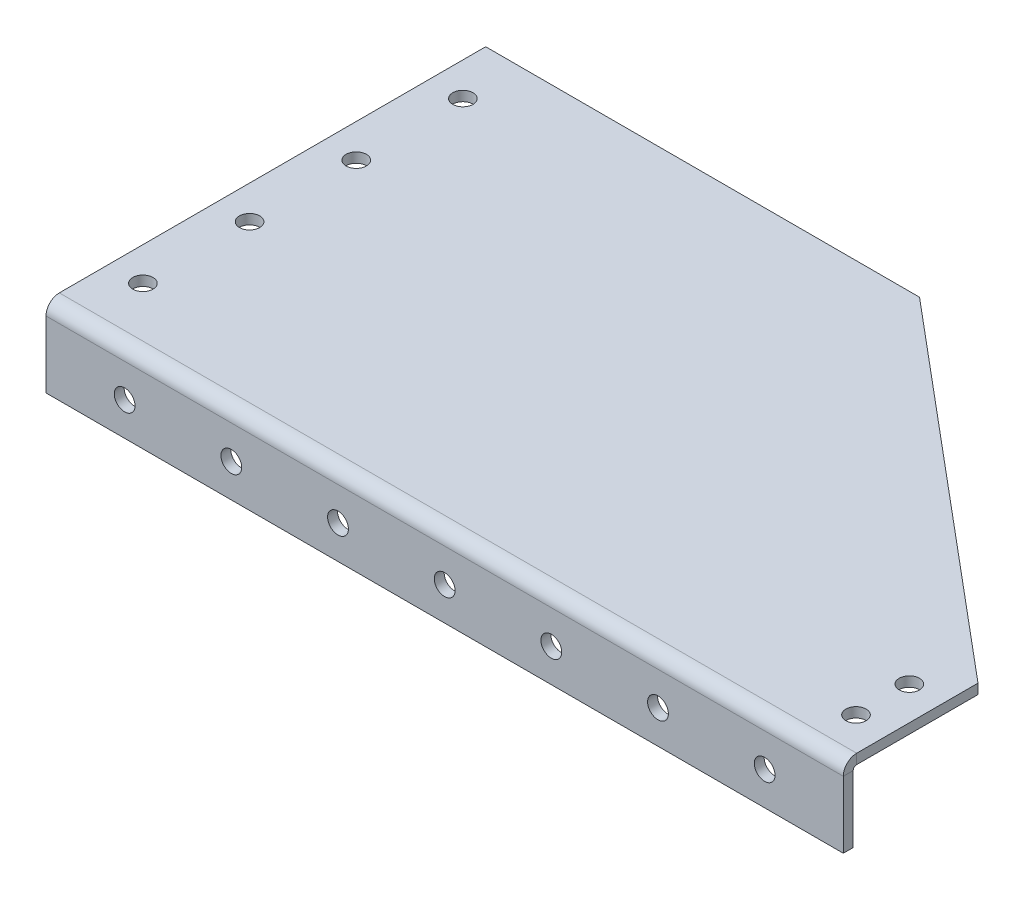
from build123d import *

# Parameters (mm, degrees)
SKETCH1_W                    = 189.8572
SKETCH1_H                    = 175.514
BASE_FLANGE1_DEPTH           = 2.3622
EDGE_FLANGE4_STRIP_W         = 11.0744
EDGE_FLANGE4_STRIP_H         = 2.3622
EDGE_FLANGE4_STRIP_CUT_DEPTH = 189.8572
EDGE_FLANGE4_DEPTH           = 189.8572
CUT_EXTRUDE1_DEPTH           = 145.352665205
CUT_EXTRUDE5_REACH           = 151.669
SKETCH41_R                   = 2.4765
CUT_EXTRUDE6_REACH           = 138.891
SKETCH42_R                   = 2.413


# Sheet-metal steps are written as plain solids
with BuildPart() as part:
    # Sketch1 → Base-Flange1 (new body)
    with BuildSketch(Plane(origin=(0, 0, 0), x_dir=(1, 0, 0), z_dir=(0, 1, 0))):
        with Locations((12.6128, 7.08)):
            Rectangle(SKETCH1_W, SKETCH1_H)
    extrude(amount=-BASE_FLANGE1_DEPTH)

    # Edge-Flange4 strip (across the edge) → Edge-Flange4 strip cut (cut)
    with BuildSketch(Plane(origin=(107.5414, -2.3622, 80.677), x_dir=(0, 0, -1), z_dir=(-1, 0, 0))):
        with Locations((-4.7244, -1.1811)):
            Rectangle(EDGE_FLANGE4_STRIP_W, EDGE_FLANGE4_STRIP_H)
    extrude(amount=EDGE_FLANGE4_STRIP_CUT_DEPTH, mode=Mode.SUBTRACT)

    # Edge-Flange4 section (across the edge) → Edge-Flange4 (add)
    with BuildSketch(Plane(origin=(107.5414, -2.3622, 80.677), x_dir=(0, 0, -1), z_dir=(-1, 0, 0))):
        with BuildLine():
            Line((-2.3622, 0.8128), (-2.3622, 16.6878))
            Line((-2.3622, 16.6878), (0, 16.6878))
            Line((0, 16.6878), (0, 0.8128))
            ThreePointArc((0, 0.8128), (0.238063608, 0.238063608), (0.8128, 0))
            Line((0.8128, 0), (0.8128, -2.3622))
            ThreePointArc((0.8128, -2.3622), (-1.43226403, -1.43226403), (-2.3622, 0.8128))
        make_face()
    extrude(amount=EDGE_FLANGE4_DEPTH)

    # Sketch36 → Cut-Extrude1 (cut, through all)
    with BuildSketch(Plane.XZ.offset(2.3622)):
        Polygon((20.98856689, -21.6596), (-82.3158, -21.6596), (-82.3158, -94.837), (107.5414, -94.837), (107.5414, 50.96685034), align=None)
    extrude(amount=-CUT_EXTRUDE1_DEPTH, mode=Mode.SUBTRACT)

    # Sketch41 → Cut-Extrude5 (cut, up to next)
    with BuildSketch(Plane(origin=(0, 0, 80.677), x_dir=(-1, 0, 0), z_dir=(0, 0, -1)), mode=Mode.PRIVATE) as cut_extrude5_sk1:
        with Locations(Location((-88.8128, -11.1125, 0), (0, 0, 90))):
            Circle(SKETCH41_R)
    cut_extrude5_tool1 = extrude(cut_extrude5_sk1.sketch, amount=-CUT_EXTRUDE5_REACH, mode=Mode.PRIVATE) & part.part
    # Sketch41 → Cut-Extrude5 (cut, up to next)
    with BuildSketch(Plane(origin=(0, 0, 80.677), x_dir=(-1, 0, 0), z_dir=(0, 0, -1)), mode=Mode.PRIVATE) as cut_extrude5_sk2:
        with Locations(Location((-63.4128, -11.1125, 0), (0, 0, 90))):
            Circle(SKETCH41_R)
    cut_extrude5_tool2 = extrude(cut_extrude5_sk2.sketch, amount=-CUT_EXTRUDE5_REACH, mode=Mode.PRIVATE) & part.part
    # Sketch41 → Cut-Extrude5 (cut, up to next)
    with BuildSketch(Plane(origin=(0, 0, 80.677), x_dir=(-1, 0, 0), z_dir=(0, 0, -1)), mode=Mode.PRIVATE) as cut_extrude5_sk3:
        with Locations(Location((-38.0128, -11.1125, 0), (0, 0, 90))):
            Circle(SKETCH41_R)
    cut_extrude5_tool3 = extrude(cut_extrude5_sk3.sketch, amount=-CUT_EXTRUDE5_REACH, mode=Mode.PRIVATE) & part.part
    # Sketch41 → Cut-Extrude5 (cut, up to next)
    with BuildSketch(Plane(origin=(0, 0, 80.677), x_dir=(-1, 0, 0), z_dir=(0, 0, -1)), mode=Mode.PRIVATE) as cut_extrude5_sk4:
        with Locations(Location((-12.6128, -11.1125, 0), (0, 0, 90))):
            Circle(SKETCH41_R)
    cut_extrude5_tool4 = extrude(cut_extrude5_sk4.sketch, amount=-CUT_EXTRUDE5_REACH, mode=Mode.PRIVATE) & part.part
    # Sketch41 → Cut-Extrude5 (cut, up to next)
    with BuildSketch(Plane(origin=(0, 0, 80.677), x_dir=(-1, 0, 0), z_dir=(0, 0, -1)), mode=Mode.PRIVATE) as cut_extrude5_sk5:
        with Locations(Location((12.7872, -11.1125, 0), (0, 0, 90))):
            Circle(SKETCH41_R)
    cut_extrude5_tool5 = extrude(cut_extrude5_sk5.sketch, amount=-CUT_EXTRUDE5_REACH, mode=Mode.PRIVATE) & part.part
    # Sketch41 → Cut-Extrude5 (cut, up to next)
    with BuildSketch(Plane(origin=(0, 0, 80.677), x_dir=(-1, 0, 0), z_dir=(0, 0, -1)), mode=Mode.PRIVATE) as cut_extrude5_sk6:
        with Locations(Location((38.1872, -11.1125, 0), (0, 0, 90))):
            Circle(SKETCH41_R)
    cut_extrude5_tool6 = extrude(cut_extrude5_sk6.sketch, amount=-CUT_EXTRUDE5_REACH, mode=Mode.PRIVATE) & part.part
    # Sketch41 → Cut-Extrude5 (cut, up to next)
    with BuildSketch(Plane(origin=(0, 0, 80.677), x_dir=(-1, 0, 0), z_dir=(0, 0, -1)), mode=Mode.PRIVATE) as cut_extrude5_sk7:
        with Locations(Location((63.5872, -11.1125, 0), (0, 0, 90))):
            Circle(SKETCH41_R)
    cut_extrude5_tool7 = extrude(cut_extrude5_sk7.sketch, amount=-CUT_EXTRUDE5_REACH, mode=Mode.PRIVATE) & part.part
    add(cut_extrude5_tool1.solids().sort_by_distance((88.8128, -11.1125, 80.677))[0], mode=Mode.SUBTRACT)
    add(cut_extrude5_tool2.solids().sort_by_distance((63.4128, -11.1125, 80.677))[0], mode=Mode.SUBTRACT)
    add(cut_extrude5_tool3.solids().sort_by_distance((38.0128, -11.1125, 80.677))[0], mode=Mode.SUBTRACT)
    add(cut_extrude5_tool4.solids().sort_by_distance((12.6128, -11.1125, 80.677))[0], mode=Mode.SUBTRACT)
    add(cut_extrude5_tool5.solids().sort_by_distance((-12.7872, -11.1125, 80.677))[0], mode=Mode.SUBTRACT)
    add(cut_extrude5_tool6.solids().sort_by_distance((-38.1872, -11.1125, 80.677))[0], mode=Mode.SUBTRACT)
    add(cut_extrude5_tool7.solids().sort_by_distance((-63.5872, -11.1125, 80.677))[0], mode=Mode.SUBTRACT)

    # Sketch42 → Cut-Extrude6 (cut, up to next)
    with BuildSketch(Plane.XZ.offset(2.3622), mode=Mode.PRIVATE) as cut_extrude6_sk1:
        with Locations(Location((-74.3402, -8.2596, 0), (0, 0, 270))):
            Circle(SKETCH42_R)
    cut_extrude6_tool1 = extrude(cut_extrude6_sk1.sketch, amount=-CUT_EXTRUDE6_REACH, mode=Mode.PRIVATE) & part.part
    # Sketch42 → Cut-Extrude6 (cut, up to next)
    with BuildSketch(Plane.XZ.offset(2.3622), mode=Mode.PRIVATE) as cut_extrude6_sk2:
        with Locations(Location((-74.3402, 17.1404, 0), (0, 0, 270))):
            Circle(SKETCH42_R)
    cut_extrude6_tool2 = extrude(cut_extrude6_sk2.sketch, amount=-CUT_EXTRUDE6_REACH, mode=Mode.PRIVATE) & part.part
    # Sketch42 → Cut-Extrude6 (cut, up to next)
    with BuildSketch(Plane.XZ.offset(2.3622), mode=Mode.PRIVATE) as cut_extrude6_sk3:
        with Locations(Location((-74.3402, 42.5404, 0), (0, 0, 270))):
            Circle(SKETCH42_R)
    cut_extrude6_tool3 = extrude(cut_extrude6_sk3.sketch, amount=-CUT_EXTRUDE6_REACH, mode=Mode.PRIVATE) & part.part
    # Sketch42 → Cut-Extrude6 (cut, up to next)
    with BuildSketch(Plane.XZ.offset(2.3622), mode=Mode.PRIVATE) as cut_extrude6_sk4:
        with Locations(Location((-74.3402, 67.9404, 0), (0, 0, 270))):
            Circle(SKETCH42_R)
    cut_extrude6_tool4 = extrude(cut_extrude6_sk4.sketch, amount=-CUT_EXTRUDE6_REACH, mode=Mode.PRIVATE) & part.part
    # Sketch42 → Cut-Extrude6 (cut, up to next)
    with BuildSketch(Plane.XZ.offset(2.3622), mode=Mode.PRIVATE) as cut_extrude6_sk5:
        with Locations(Location((99.5658, 59.3432, 0), (0, 0, 270))):
            Circle(SKETCH42_R)
    cut_extrude6_tool5 = extrude(cut_extrude6_sk5.sketch, amount=-CUT_EXTRUDE6_REACH, mode=Mode.PRIVATE) & part.part
    # Sketch42 → Cut-Extrude6 (cut, up to next)
    with BuildSketch(Plane.XZ.offset(2.3622), mode=Mode.PRIVATE) as cut_extrude6_sk6:
        with Locations(Location((99.5658, 72.0432, 0), (0, 0, 270))):
            Circle(SKETCH42_R)
    cut_extrude6_tool6 = extrude(cut_extrude6_sk6.sketch, amount=-CUT_EXTRUDE6_REACH, mode=Mode.PRIVATE) & part.part
    add(cut_extrude6_tool1.solids().sort_by_distance((-74.3402, -2.3622, -8.2596))[0], mode=Mode.SUBTRACT)
    add(cut_extrude6_tool2.solids().sort_by_distance((-74.3402, -2.3622, 17.1404))[0], mode=Mode.SUBTRACT)
    add(cut_extrude6_tool3.solids().sort_by_distance((-74.3402, -2.3622, 42.5404))[0], mode=Mode.SUBTRACT)
    add(cut_extrude6_tool4.solids().sort_by_distance((-74.3402, -2.3622, 67.9404))[0], mode=Mode.SUBTRACT)
    add(cut_extrude6_tool5.solids().sort_by_distance((99.5658, -2.3622, 59.3432))[0], mode=Mode.SUBTRACT)
    add(cut_extrude6_tool6.solids().sort_by_distance((99.5658, -2.3622, 72.0432))[0], mode=Mode.SUBTRACT)


solid = part.part
